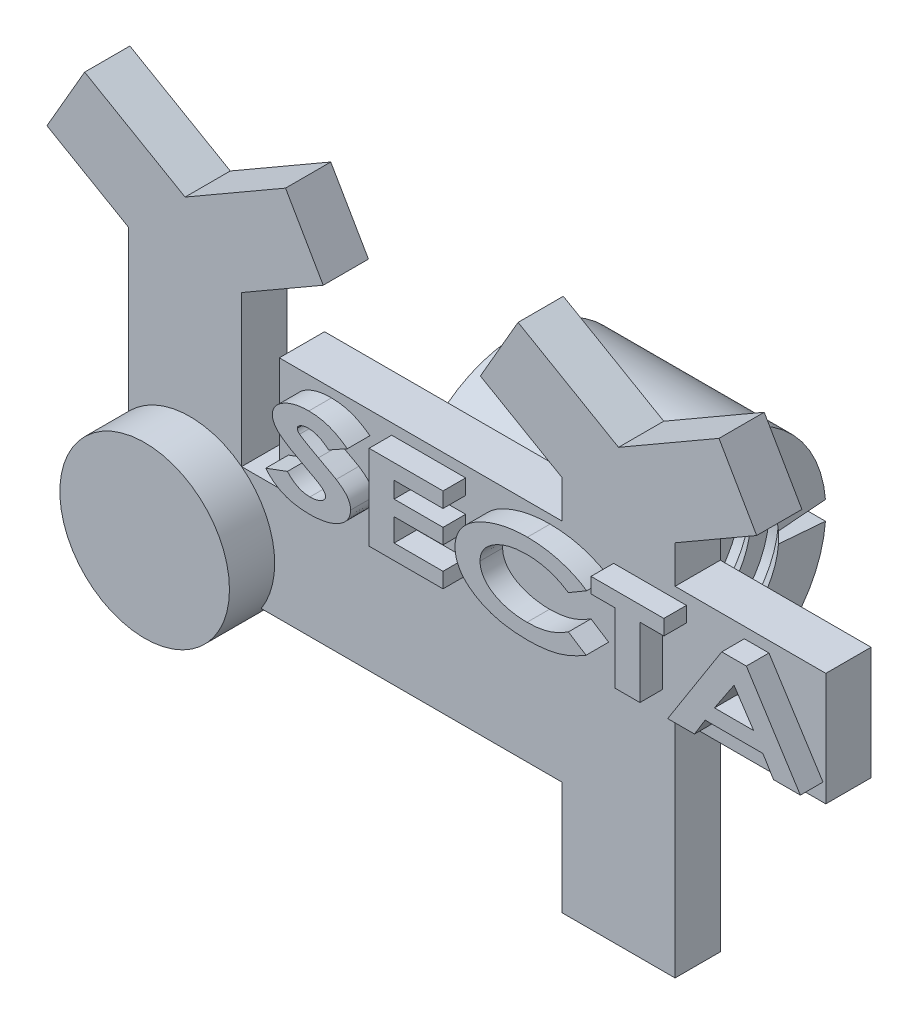
from build123d import *

# Parameters (mm, degrees)
SALIENTE_EXTRUIR1_DEPTH      = 2.4
SALIENTE_EXTRUIR2_DEPTH      = 2.4
SALIENTE_EXTRUIR2_DEPTH_BACK = 2.4
CROQUIS2_R                   = 4.5
SALIENTE_EXTRUIR3_DEPTH      = 1.2
SALIENTE_EXTRUIR4_START      = -15.5
SALIENTE_EXTRUIR4_DEPTH      = 10
REVOLUCI_N2_ANGLE            = 350.852157


# Read off the part's stored shape, not the designer's step: Revolución2
with BuildPart() as part:
    # Croquis1 → Saliente-Extruir1 (new body)
    with BuildSketch(Plane.XY):
        Polygon((-8, -12), (-14, -12), (-14, -6), (-37, -6), (-37, 8), (-41.330127019, 10.5), (-39.330127019, 13.964101615), (-34, 10.886751346), (-28.669872981, 13.964101615), (-26.669872981, 10.5), (-31, 8), (-31, 0), (-29, 0), (-29, 6), (-14, 6), (-14, 8), (-18.330127019, 10.5), (-16.330127019, 13.964101615), (-11, 10.886751346), (-5.669872981, 13.964101615), (-3.669872981, 10.5), (-8, 8), (-8, 6), (0, 6), (0, 0), (-8, 0), align=None)
    extrude(amount=SALIENTE_EXTRUIR1_DEPTH)

    # Croquis2 → Saliente-Extruir2 (add, two sides: drawn at the far end of the back side and taken through both)
    with BuildSketch(Plane.XY.offset(2.4).offset(-SALIENTE_EXTRUIR2_DEPTH_BACK)):
        with Locations((-33.744908232, -3.565877002)):
            Circle(CROQUIS2_R)
    extrude(amount=SALIENTE_EXTRUIR2_DEPTH + SALIENTE_EXTRUIR2_DEPTH_BACK)

    # Croquis4 → Saliente-Extruir3 (add)
    # profile 1 of 5: a face of its own
    with BuildSketch(Plane.XY.offset(2.4)):
        with BuildLine():
            Line((-24.192307692, 4.825075565), (-25.183894231, 4.27249143))
            add(Edge.make_bspline(
                [(-25.183894231, 4.27249143), (-25.226919521, 4.309235401), (-25.310921586, 4.380973891), (-25.44300624, 4.474503478), (-25.57494017, 4.554736812), (-25.707934149, 4.620047496), (-25.841884622, 4.67105453), (-25.976583426, 4.707083688), (-26.111905597, 4.729870519), (-26.20243685, 4.732645607), (-26.247596154, 4.734029892)],
                knots=[0, 0, 0, 0, 1.144796943, 2.235087903, 3.271950806, 4.267549238, 5.230026978, 6.168390537, 7.086346384, 8, 8, 8, 8], degree=3))
            add(Edge.make_bspline(
                [(-26.247596154, 4.734029892), (-26.289424602, 4.733153893), (-26.369562474, 4.731475594), (-26.484031555, 4.714354255), (-26.586771926, 4.685665755), (-26.6761846, 4.647005328), (-26.748660996, 4.600831216), (-26.803911953, 4.552167689), (-26.838911098, 4.497375224), (-26.84382007, 4.457984847), (-26.846153846, 4.439258257)],
                knots=[0, 0, 0, 0, 1.392129176, 2.667138632, 3.84227936, 4.935454925, 5.89858118, 6.691521191, 7.377935727, 8, 8, 8, 8], degree=3))
            add(Edge.make_bspline(
                [(-26.846153846, 4.439258257), (-26.844845537, 4.420373796), (-26.842149476, 4.381458201), (-26.816134665, 4.325733024), (-26.777704966, 4.271256116), (-26.742929276, 4.240270627), (-26.724459135, 4.223813546)],
                knots=[0, 0, 0, 0, 0.882707917, 1.819014285, 2.841630067, 4, 4, 4, 4], degree=3))
            add(Edge.make_bspline(
                [(-26.724459135, 4.223813546), (-26.70716928, 4.210697442), (-26.66689923, 4.180148536), (-26.59337581, 4.132820466), (-26.500289619, 4.0742192), (-26.385267259, 4.007155467), (-26.250202075, 3.929117481), (-26.092994818, 3.843681459), (-25.91659167, 3.74531642), (-25.790990693, 3.678511715), (-25.724759615, 3.643284699)],
                knots=[0, 0, 0, 0, 0.450074539, 1.048275106, 1.812777656, 2.732189609, 3.810011812, 5.048794557, 6.443789853, 8, 8, 8, 8], degree=3))
            add(Edge.make_bspline(
                [(-25.724759615, 3.643284699), (-25.662851598, 3.61054962), (-25.545567289, 3.548533238), (-25.379215317, 3.460234009), (-25.232592385, 3.380629208), (-25.104381152, 3.311837263), (-24.996313352, 3.251000464), (-24.90672063, 3.20082688), (-24.836479309, 3.15950506), (-24.796241404, 3.134624323), (-24.779146635, 3.12405393)],
                knots=[0, 0, 0, 0, 1.557729856, 2.951108395, 4.189202345, 5.268860485, 6.187465346, 6.947688418, 7.552933379, 8, 8, 8, 8], degree=3))
            add(Edge.make_bspline(
                [(-24.779146635, 3.12405393), (-24.745624529, 3.102367723), (-24.680599264, 3.060301409), (-24.588625488, 2.994912237), (-24.503390955, 2.931503644), (-24.427229566, 2.867043774), (-24.357014925, 2.805015658), (-24.29466236, 2.742739252), (-24.239952943, 2.680948997), (-24.177464976, 2.600954471), (-24.114353967, 2.498189698), (-24.058957494, 2.368077238), (-24.025432867, 2.231810055), (-24.021303487, 2.138659077), (-24.019230769, 2.091902488)],
                knots=[0, 0, 0, 0, 1.070878652, 2.077261218, 3.026806543, 3.919535016, 4.752941277, 5.539501526, 6.28186576, 6.965498631, 8.260851439, 9.503440935, 10.746866769, 12, 12, 12, 12], degree=3))
            add(Edge.make_bspline(
                [(-24.019230769, 2.091902488), (-24.021225883, 2.046388603), (-24.025162066, 1.956593709), (-24.053916989, 1.824825276), (-24.101962891, 1.699615496), (-24.170078124, 1.580956355), (-24.25688378, 1.468643362), (-24.361997442, 1.361487696), (-24.488019379, 1.263070384), (-24.629645969, 1.169520308), (-24.787082803, 1.085611466), (-24.956963559, 1.011461598), (-25.138821289, 0.94934789), (-25.33212297, 0.899368812), (-25.536835489, 0.859635813), (-25.752947944, 0.83114072), (-25.980779388, 0.81366997), (-26.136386151, 0.811872926), (-26.216045673, 0.810952969)],
                knots=[0, 0, 0, 0, 0.778645729, 1.536199556, 2.296471887, 3.065788088, 3.869161519, 4.720163113, 5.627776405, 6.600599383, 7.622238928, 8.677086202, 9.770036052, 10.907689888, 12.091823603, 13.337058766, 14.636764725, 16, 16, 16, 16], degree=3))
            add(Edge.make_bspline(
                [(-26.216045673, 0.810952969), (-26.278862692, 0.811613903), (-26.402188738, 0.812911487), (-26.584138058, 0.824072309), (-26.75981156, 0.841825212), (-26.929760665, 0.867140244), (-27.09350231, 0.899245573), (-27.251131566, 0.939142332), (-27.402545238, 0.985888772), (-27.54819372, 1.039742336), (-27.687679504, 1.102538784), (-27.822154113, 1.17262053), (-27.951366726, 1.251594628), (-28.076264597, 1.337864302), (-28.194814057, 1.433872974), (-28.309206927, 1.536758813), (-28.417527902, 1.648872099), (-28.485118563, 1.728831552), (-28.519230769, 1.769186142)],
                knots=[0, 0, 0, 0, 1.1656978, 2.288566092, 3.381684239, 4.4416263, 5.476209922, 6.477059963, 7.457759757, 8.415892537, 9.356930802, 10.29479133, 11.228214832, 12.165660798, 13.10971789, 14.057260176, 15.019522194, 16, 16, 16, 16], degree=3))
            Line((-28.519230769, 1.769186142), (-27.369891827, 2.195568353))
            add(Edge.make_bspline(
                [(-27.369891827, 2.195568353), (-27.326878803, 2.149617425), (-27.242766395, 2.059759915), (-27.104823389, 1.942623324), (-26.962827441, 1.842220632), (-26.815241766, 1.760731057), (-26.662944246, 1.696978834), (-26.505695985, 1.651714203), (-26.343252193, 1.623681536), (-26.232984667, 1.620335505), (-26.177283654, 1.618645276)],
                knots=[0, 0, 0, 0, 1.104549774, 2.159958392, 3.171518491, 4.154034384, 5.11440821, 6.064653456, 7.02237072, 8, 8, 8, 8], degree=3))
            add(Edge.make_bspline(
                [(-26.177283654, 1.618645276), (-26.120989658, 1.62005089), (-26.012343754, 1.622763687), (-25.85664514, 1.64771586), (-25.713942821, 1.686386449), (-25.607218871, 1.734622992), (-25.53095931, 1.778258902), (-25.482277778, 1.812604775), (-25.440114595, 1.847701985), (-25.405740827, 1.884529266), (-25.378809327, 1.92260654), (-25.360756038, 1.962489796), (-25.347985789, 2.003075864), (-25.346761569, 2.031110582), (-25.346153846, 2.045027488)],
                knots=[0, 0, 0, 0, 2.000080528, 3.860101882, 5.591711695, 7.241573856, 8.007496713, 8.712915002, 9.3571957, 9.95440764, 10.499672279, 11.006310789, 11.506715953, 12, 12, 12, 12], degree=3))
            add(Edge.make_bspline(
                [(-25.346153846, 2.045027488), (-25.348239201, 2.070942283), (-25.352586387, 2.124964954), (-25.390964671, 2.203007862), (-25.448179949, 2.280722516), (-25.514214503, 2.343308112), (-25.582059449, 2.395058844), (-25.647383562, 2.441422812), (-25.726444628, 2.492094868), (-25.819005406, 2.548325637), (-25.925335169, 2.609220624), (-26.044860486, 2.67577012), (-26.17800202, 2.747266769), (-26.271568792, 2.795754085), (-26.320612981, 2.821169315)],
                knots=[0, 0, 0, 0, 0.719620744, 1.500140495, 2.382110041, 3.407752025, 4.023146351, 4.762800511, 5.641737031, 6.64237355, 7.784062873, 9.059959673, 10.45894125, 12, 12, 12, 12], degree=3))
            add(Edge.make_bspline(
                [(-26.320612981, 2.821169315), (-26.368459463, 2.84567455), (-26.462008447, 2.89358695), (-26.598052081, 2.966124363), (-26.728282458, 3.035606872), (-26.852361866, 3.102717503), (-26.969340368, 3.16861793), (-27.079874913, 3.232097137), (-27.184213841, 3.292789495), (-27.281477135, 3.352655417), (-27.372939784, 3.409563727), (-27.457987116, 3.463803993), (-27.536153138, 3.516806133), (-27.608250882, 3.56691886), (-27.673715651, 3.615399427), (-27.732827542, 3.661463412), (-27.784903573, 3.705640291), (-27.845809442, 3.760123378), (-27.91153798, 3.827869305), (-27.981090217, 3.909608617), (-28.039650506, 3.991311051), (-28.088116794, 4.07325264), (-28.126508849, 4.154820462), (-28.152520589, 4.237055511), (-28.169956374, 4.318632083), (-28.172042788, 4.37336685), (-28.173076923, 4.400496238)],
                knots=[0, 0, 0, 0, 1.527752317, 2.987046655, 4.381534809, 5.722815918, 6.996037519, 8.197198144, 9.345466108, 10.426340658, 11.442891163, 12.407010941, 13.292840506, 14.126765819, 14.902190045, 15.60773904, 16.256140062, 16.842652159, 17.929649168, 18.935598672, 19.890598399, 20.782540177, 21.638432253, 22.445922123, 23.229718433, 24, 24, 24, 24], degree=3))
            add(Edge.make_bspline(
                [(-28.173076923, 4.400496238), (-28.171332958, 4.439115335), (-28.167872434, 4.515746655), (-28.140274372, 4.628176318), (-28.096954996, 4.736645399), (-28.034402099, 4.840036268), (-27.954790236, 4.939178338), (-27.857594728, 5.03372198), (-27.743147048, 5.123864571), (-27.613030887, 5.208721489), (-27.469978861, 5.28611098), (-27.317394775, 5.354995406), (-27.156225026, 5.412373324), (-26.987382795, 5.460394313), (-26.810220466, 5.497174122), (-26.625035089, 5.523120736), (-26.431752744, 5.538517619), (-26.300208347, 5.540640417), (-26.233173077, 5.541722199)],
                knots=[0, 0, 0, 0, 0.750986067, 1.490170878, 2.240724014, 3.017156197, 3.83291239, 4.709793601, 5.650705905, 6.664670556, 7.729957895, 8.813839263, 9.920261115, 11.057155333, 12.228423976, 13.439459984, 14.695144019, 16, 16, 16, 16], degree=3))
            add(Edge.make_bspline(
                [(-26.233173077, 5.541722199), (-26.1459499, 5.539811999), (-25.973426712, 5.536033716), (-25.71789947, 5.506014802), (-25.468743649, 5.458927461), (-25.265554368, 5.401927605), (-25.104286181, 5.345639344), (-24.980879285, 5.295174591), (-24.855593259, 5.235928582), (-24.726973154, 5.170437519), (-24.596827454, 5.094993964), (-24.463217184, 5.013324641), (-24.327779063, 4.922853281), (-24.238080357, 4.85811241), (-24.192307692, 4.825075565)],
                knots=[0, 0, 0, 0, 1.424089512, 2.816779558, 4.195891129, 5.561527259, 6.25835624, 6.984627267, 7.737611116, 8.521108524, 9.34096556, 10.193521101, 11.07816558, 12, 12, 12, 12], degree=3))
        make_face()
    # profile 2 of 5: a face of its own
    with BuildSketch(Plane.XY.offset(2.4)):
        Polygon((-23.035576923, 5.426337584), (-19.1125, 5.426337584), (-19.1125, 4.618645276), (-21.708653846, 4.618645276), (-21.708653846, 3.753260661), (-19.1125, 3.753260661), (-19.1125, 2.945568353), (-21.708653846, 2.945568353), (-21.708653846, 1.734029892), (-19.1125, 1.734029892), (-19.1125, 0.926337584), (-23.035576923, 0.926337584), align=None)
    # profile 3 of 5: a face of its own
    with BuildSketch(Plane.XY.offset(2.4)):
        with BuildLine():
            Line((-11.494230769, 4.645688546), (-12.461478365, 4.079582776))
            add(Edge.make_bspline(
                [(-12.461478365, 4.079582776), (-12.544289436, 4.131887712), (-12.70893723, 4.235882169), (-12.967709373, 4.369570214), (-13.2349627, 4.481070871), (-13.508945238, 4.574844948), (-13.791643594, 4.64568237), (-14.081359757, 4.697070998), (-14.379043474, 4.728675173), (-14.580090964, 4.732231823), (-14.681730769, 4.734029892)],
                knots=[0, 0, 0, 0, 1.000465043, 1.98915872, 2.971640436, 3.957111076, 4.945256385, 5.94622067, 6.961709345, 8, 8, 8, 8], degree=3))
            add(Edge.make_bspline(
                [(-14.681730769, 4.734029892), (-14.766807302, 4.732614733), (-14.933613121, 4.729840095), (-15.178736129, 4.708948819), (-15.41352726, 4.673751146), (-15.638708179, 4.625507751), (-15.853448947, 4.562274824), (-16.058280977, 4.48569033), (-16.25235326, 4.394501415), (-16.434067486, 4.290723345), (-16.600277398, 4.177562223), (-16.746196027, 4.055929366), (-16.870201552, 3.927577603), (-16.971329203, 3.792162), (-17.051341788, 3.650423272), (-17.107374496, 3.501164008), (-17.142253146, 3.345315182), (-17.146123081, 3.239018692), (-17.148076923, 3.185352007)],
                knots=[0, 0, 0, 0, 1.273167119, 2.496242804, 3.678550535, 4.824339787, 5.939965159, 7.025799381, 8.094030328, 9.145459928, 10.154579224, 11.099447358, 11.983659447, 12.819211474, 13.622469174, 14.41092516, 15.197712182, 16, 16, 16, 16], degree=3))
            add(Edge.make_bspline(
                [(-17.148076923, 3.185352007), (-17.147415614, 3.147727083), (-17.146108387, 3.073352918), (-17.129475318, 2.96370395), (-17.106065882, 2.856804626), (-17.070101266, 2.75393244), (-17.025862091, 2.65391101), (-16.971328936, 2.557174091), (-16.907261742, 2.463244728), (-16.833169017, 2.37324015), (-16.74995472, 2.287330187), (-16.657794645, 2.206639788), (-16.558275277, 2.129695963), (-16.45080782, 2.057129788), (-16.334226304, 1.991157083), (-16.210216908, 1.928324455), (-16.077791861, 1.871334993), (-15.938537212, 1.817777173), (-15.792564168, 1.771701839), (-15.642458064, 1.729774273), (-15.487700082, 1.69568223), (-15.329102464, 1.668203354), (-15.166867918, 1.644955994), (-15.000433419, 1.63053195), (-14.830012806, 1.619621949), (-14.714802376, 1.618973486), (-14.656490385, 1.618645276)],
                knots=[0, 0, 0, 0, 0.830945717, 1.642551973, 2.446594014, 3.246896049, 4.046756933, 4.861591236, 5.698014292, 6.556999256, 7.435410672, 8.338952563, 9.262321444, 10.214761384, 11.20258315, 12.221471147, 13.286409055, 14.388022435, 15.518142965, 16.668710983, 17.832243558, 19.019275871, 20.22635821, 21.453738207, 22.71124865, 24, 24, 24, 24], degree=3))
            add(Edge.make_bspline(
                [(-14.656490385, 1.618645276), (-14.558479025, 1.620411909), (-14.366006122, 1.623881189), (-14.084005172, 1.650038065), (-13.814796067, 1.694421697), (-13.598352905, 1.745650094), (-13.428470487, 1.797304223), (-13.29967663, 1.845079594), (-13.16705737, 1.897774166), (-13.031696922, 1.95876245), (-12.892716193, 2.025958407), (-12.751716033, 2.102246686), (-12.606883075, 2.184160309), (-12.51058721, 2.243056557), (-12.461478365, 2.273092392)],
                knots=[0, 0, 0, 0, 1.517099692, 2.97925243, 4.379421106, 5.737784246, 6.419017464, 7.126793621, 7.863581755, 8.627744198, 9.42450828, 10.252748223, 11.108938718, 12, 12, 12, 12], degree=3))
            Line((-12.461478365, 2.273092392), (-11.523978365, 1.670027488))
            add(Edge.make_bspline(
                [(-11.523978365, 1.670027488), (-11.589866389, 1.63089097), (-11.719693426, 1.55377562), (-11.915195728, 1.446317988), (-12.108473976, 1.34948377), (-12.297754192, 1.259261056), (-12.485165811, 1.179927018), (-12.670221171, 1.111080552), (-12.851582723, 1.048595885), (-13.032422653, 0.997560002), (-13.21480409, 0.952437403), (-13.402047536, 0.915306611), (-13.595238215, 0.882366907), (-13.794974582, 0.856691538), (-14.000848718, 0.835695517), (-14.213133376, 0.821796079), (-14.43134112, 0.812187513), (-14.578955449, 0.81136827), (-14.653786058, 0.810952969)],
                knots=[0, 0, 0, 0, 1.116919084, 2.20079896, 3.250609473, 4.267388355, 5.256504417, 6.215552819, 7.144850743, 8.051425286, 8.95323759, 9.882566473, 10.832956071, 11.809130983, 12.817090507, 13.848664173, 14.909416376, 16, 16, 16, 16], degree=3))
            add(Edge.make_bspline(
                [(-14.653786058, 0.810952969), (-14.722906065, 0.811438621), (-14.859691786, 0.812399709), (-15.062555949, 0.821077022), (-15.260983826, 0.833250386), (-15.454582999, 0.851296303), (-15.643403282, 0.874597786), (-15.827259539, 0.903853507), (-16.00674088, 0.936332544), (-16.180825441, 0.976788095), (-16.350605366, 1.020454944), (-16.515219787, 1.070284035), (-16.675796791, 1.124137214), (-16.830986852, 1.184720215), (-16.98194907, 1.249284398), (-17.127583541, 1.320151969), (-17.268666888, 1.395536662), (-17.404785058, 1.475557845), (-17.533832281, 1.55977608), (-17.655328935, 1.647304488), (-17.767608154, 1.738530782), (-17.872942194, 1.831381532), (-17.969705449, 1.927659287), (-18.056733746, 2.028066389), (-18.136984543, 2.130125749), (-18.207982429, 2.23578825), (-18.271536331, 2.343875109), (-18.325588208, 2.45528507), (-18.371881381, 2.569350723), (-18.409889173, 2.686463496), (-18.438566401, 2.80681331), (-18.459258447, 2.929679867), (-18.472299239, 3.055565471), (-18.474092593, 3.140548909), (-18.475, 3.183549122)],
                knots=[0, 0, 0, 0, 1.332695775, 2.637351488, 3.914573827, 5.165626706, 6.385872522, 7.582268218, 8.755001435, 9.901903064, 11.027533841, 12.134657037, 13.217484645, 14.292362361, 15.346028539, 16.38254251, 17.414187142, 18.429713001, 19.426050768, 20.38448865, 21.315585414, 22.214377371, 23.09110566, 23.945180852, 24.774994998, 25.592932072, 26.397837579, 27.190746929, 27.978303889, 28.769836126, 29.562406716, 30.361557218, 31.170975064, 32, 32, 32, 32], degree=3))
            add(Edge.make_bspline(
                [(-18.475, 3.183549122), (-18.473785493, 3.238925736), (-18.471371684, 3.348985679), (-18.446835338, 3.511020848), (-18.408980933, 3.668635775), (-18.355790343, 3.821267368), (-18.28636546, 3.9692084), (-18.202723551, 4.112393918), (-18.103189381, 4.250700647), (-17.988581396, 4.383672271), (-17.859872774, 4.511467458), (-17.71720785, 4.632192986), (-17.563026633, 4.748488266), (-17.393828314, 4.855888833), (-17.21236255, 4.957872305), (-17.017950151, 5.05352182), (-16.810256436, 5.142613144), (-16.59063275, 5.224912925), (-16.362332555, 5.299148216), (-16.12837035, 5.364251973), (-15.889855412, 5.419259798), (-15.647178925, 5.464408476), (-15.399824695, 5.498220768), (-15.148529856, 5.52396688), (-14.892531391, 5.538130641), (-14.720508462, 5.540519988), (-14.633954327, 5.541722199)],
                knots=[0, 0, 0, 0, 0.802734483, 1.595419208, 2.3713548, 3.151550955, 3.93542733, 4.738280132, 5.553519112, 6.40352961, 7.281897666, 8.181549112, 9.112540013, 10.080976543, 11.086002615, 12.130796417, 13.222189586, 14.362844853, 15.53167316, 16.70335042, 17.8843298, 19.081152094, 20.282513389, 21.504662868, 22.744459539, 24, 24, 24, 24], degree=3))
            add(Edge.make_bspline(
                [(-14.633954327, 5.541722199), (-14.560022202, 5.541038651), (-14.412680101, 5.539676383), (-14.192915704, 5.528419291), (-13.974866237, 5.510811627), (-13.759430794, 5.484144557), (-13.545483627, 5.45221806), (-13.334339569, 5.411070758), (-13.124506008, 5.364772576), (-12.918162654, 5.309484781), (-12.715876611, 5.248900726), (-12.520332919, 5.18093532), (-12.331084533, 5.108255242), (-12.149648163, 5.028005632), (-11.974851405, 4.94211841), (-11.807351876, 4.850530483), (-11.646999565, 4.75209108), (-11.544984001, 4.681037862), (-11.494230769, 4.645688546)],
                knots=[0, 0, 0, 0, 1.07027023, 2.132981633, 3.184963682, 4.2365859, 5.275089204, 6.31594048, 7.35020766, 8.385325281, 9.407824875, 10.406591267, 11.38165812, 12.34189163, 13.277662355, 14.200461515, 15.104720988, 16, 16, 16, 16], degree=3))
        make_face()
    # profile 4 of 5: a face of its own
    with BuildSketch(Plane.XY.offset(2.4)):
        Polygon((-11.260576923, 5.426337584), (-7.395192308, 5.426337584), (-7.395192308, 4.618645276), (-8.664423077, 4.618645276), (-8.664423077, 0.926337584), (-9.991346154, 0.926337584), (-9.991346154, 4.618645276), (-11.260576923, 4.618645276), align=None)
    # profile 5 of 5: a face of its own
    with BuildSketch(Plane.XY.offset(2.4)):
        Polygon((-4.322896635, 5.426337584), (-3.017608173, 5.426337584), (-0.151923077, 0.926337584), (-1.574399038, 0.926337584), (-2.138701923, 1.849414507), (-5.204507212, 1.849414507), (-5.768810096, 0.926337584), (-7.190384615, 0.926337584), align=None)
        Polygon((-3.671153846, 4.219306334), (-4.710516827, 2.657106815), (-2.631790865, 2.657106815), align=None, mode=Mode.SUBTRACT)
    extrude(amount=SALIENTE_EXTRUIR3_DEPTH)

    # Croquis5 → Saliente-Extruir4 (add)
    with BuildSketch(Plane.ZY.offset(29).offset(SALIENTE_EXTRUIR4_START)):
        with BuildLine():
            Line((0, 3.942080669), (0, -3.942080669))
            ThreePointArc((0, -3.942080669), (-6.704962769, -5.968384465), (-11.080095491, -0.498407639))
            Line((-11.080095491, -0.498407639), (-9.584872573, -0.378789806))
            ThreePointArc((-9.584872573, -0.378789806), (-0.1, 0), (-9.584872573, 0.378789806))
            Line((-9.584872573, 0.378789806), (-11.080095491, 0.498407639))
            ThreePointArc((-11.080095491, 0.498407639), (-6.704962769, 5.968384465), (0, 3.942080669))
        make_face()
    extrude(amount=SALIENTE_EXTRUIR4_DEPTH)

    # Revolución2 outline → Revolución2 (revolve)
    with BuildSketch(Plane(origin=(0, 0, -4.85), x_dir=(0, 0.07974522228289029, -0.996815278536125), z_dir=(0, -0.996815278536125, -0.07974522228289029))):
        Polygon((4.75, -22.5), (3.75, -23.5), (4.75, -23.5), align=None)
        Polygon((3.75, -22), (4.75, -22), (4.75, -21), align=None)
        Polygon((3.75, -20.5), (4.75, -20.5), (4.75, -19.5), align=None)
        Polygon((3.75, -16.5), (4.75, -17.5), (4.75, -16.5), align=None)
        Polygon((3.75, -15), (4.75, -16), (4.75, -15), align=None)
        Polygon((3.75, -13.5), (4.75, -14.5), (4.75, -13.5), align=None)
    revolve(axis=Axis((0, 0, -4.85), (1, 0, 0)), revolution_arc=REVOLUCI_N2_ANGLE)


solid = part.part
